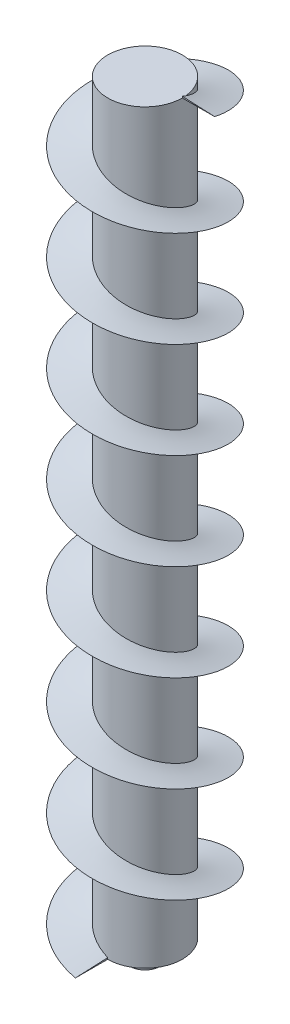
from build123d import *

# Parameters (mm, degrees)
SKETCH_1_R          = 7.5
EXTRUDE_1_DEPTH     = 150
SWEEP_2_PITCH       = 19.35483871
SWEEP_2_HEIGHT      = 150
SWEEP_2_RADIUS      = 7.5
SKETCH_8_R          = 3
EXTRUDE_2_DEPTH     = 5
CUT_EXTRUDE_START   = -1.5
SKETCH_9_R          = 3
CUT_EXTRUDE_1_DEPTH = 1.5


with BuildPart() as part:
    # 草圖1 → 填料-伸長1 (new body)
    with BuildSketch(Plane(origin=(0, 0, 0), x_dir=(1, 0, 0), z_dir=(0, 1, 0))):
        with Locations(Location((0, 0, 0), (0, 0, 270))):
            Circle(SKETCH_1_R)
    extrude(amount=EXTRUDE_1_DEPTH)

    # 掃出2: sweep along a helix
    with BuildLine() as sweep_2_path:
        Helix(SWEEP_2_PITCH, SWEEP_2_HEIGHT, SWEEP_2_RADIUS, center=(0, 0, 0), direction=(0, 1, 0), lefthand=True)
    # 草圖4 → 掃出2 (sweep)
    with BuildSketch(Plane(origin=(0, 0, 0), x_dir=(0, 0, -1), z_dir=(1, 0, 0))):
        Polygon((-7.5, 0.3), (-14, 0), (-7.5, 0), align=None)
    sweep(path=sweep_2_path.line, is_frenet=True)

    # 草圖8 → 填料-伸長2 (add)
    with BuildSketch(Plane.XZ):
        with Locations(Location((0, 0, 0), (0, 0, 90))):
            Circle(SKETCH_8_R)
    extrude(amount=EXTRUDE_2_DEPTH)

    # 草圖9 → 除料-伸長1 (cut)
    with BuildSketch(Plane.XZ.offset(5).offset(CUT_EXTRUDE_START)):
        with Locations(Location((0, 0, 0), (0, 0, 90))):
            Circle(SKETCH_9_R)
    extrude(amount=CUT_EXTRUDE_1_DEPTH, mode=Mode.SUBTRACT)


solid = part.part
